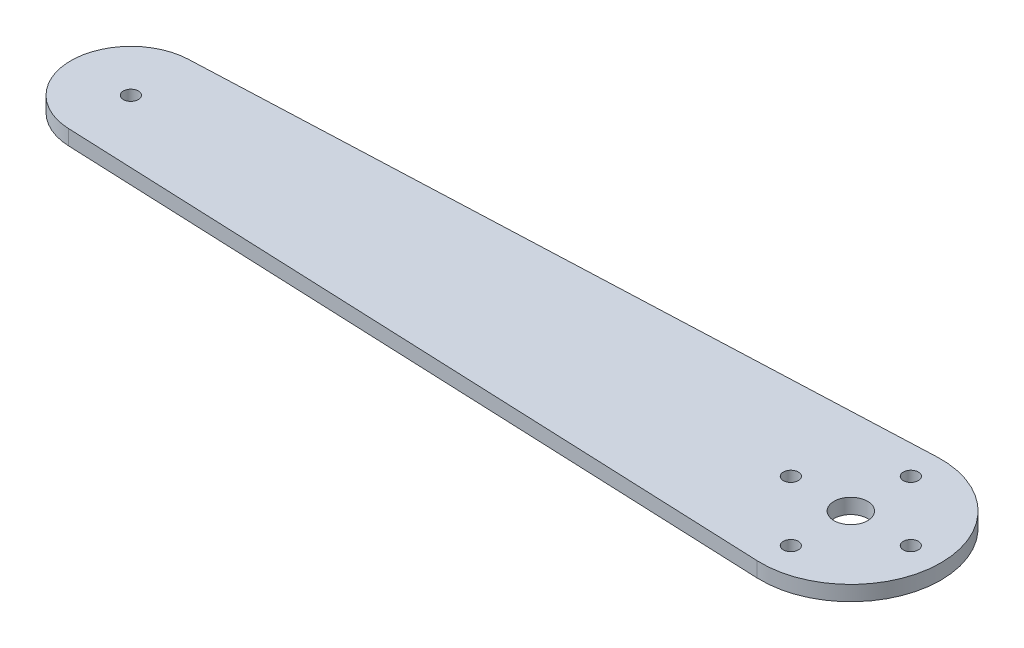
from build123d import *

# Parameters (mm, degrees)
SKETCH1_R           = 1.5875
SKETCH1_R_2         = 3.556
BOSS_EXTRUDE1_DEPTH = 3.175


with BuildPart() as part:
    # Sketch1 → Boss-Extrude1 (new body)
    with BuildSketch(Plane(origin=(0, 0, 0), x_dir=(1, 0, 0), z_dir=(0, 1, 0))):
        with BuildLine():
            Line((-152.929166667, 12.688970905), (-0.79375, 19.033456358))
            ThreePointArc((-0.79375, 19.033456358), (19.05, 0), (-0.79375, -19.033456358))
            Line((-0.79375, -19.033456358), (-152.929166667, -12.688970905))
            ThreePointArc((-152.929166667, -12.688970905), (-165.1, 0), (-152.929166667, 12.688970905))
        make_face()
        with Locations((-152.4, 0)):
            Circle(SKETCH1_R, mode=Mode.SUBTRACT)
        Circle(SKETCH1_R_2, mode=Mode.SUBTRACT)
        with Locations((0, 12.7)):
            Circle(SKETCH1_R, mode=Mode.SUBTRACT)
        with Locations((12.7, 0)):
            Circle(SKETCH1_R, mode=Mode.SUBTRACT)
        with Locations((0, -12.7)):
            Circle(SKETCH1_R, mode=Mode.SUBTRACT)
        with Locations((-12.7, 0)):
            Circle(SKETCH1_R, mode=Mode.SUBTRACT)
    extrude(amount=BOSS_EXTRUDE1_DEPTH)


solid = part.part
